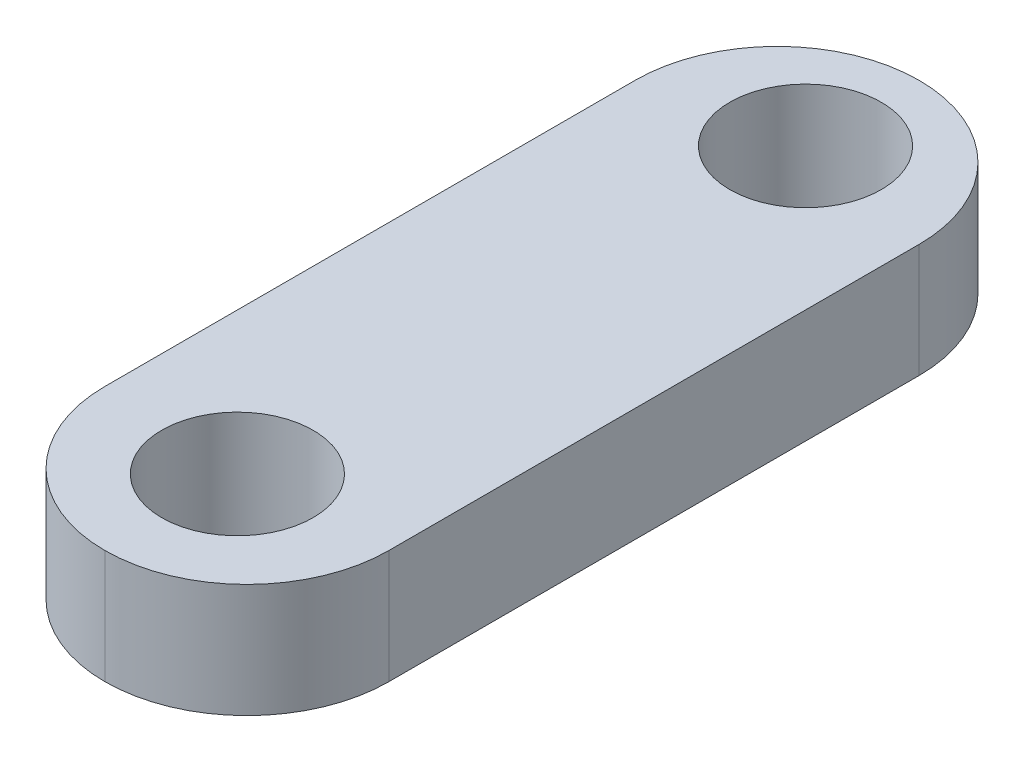
from build123d import *

# Parameters (mm, degrees)
SKETCH1_W           = 15
SKETCH1_H           = 43
BOSS_EXTRUDE1_DEPTH = 6
SKETCH4_R           = 4
CUT_EXTRUDE2_DEPTH  = 46.934736311
FILLET1_R           = 7.5


with BuildPart() as part:
    # Sketch1 → Boss-Extrude1 (new body)
    with BuildSketch(Plane(origin=(0, 0, 0), x_dir=(1, 0, 0), z_dir=(0, 1, 0))):
        with Locations((7.5, 21.5)):
            Rectangle(SKETCH1_W, SKETCH1_H)
    extrude(amount=BOSS_EXTRUDE1_DEPTH)

    # Sketch4 → Cut-Extrude2 (cut, through all)
    with BuildSketch(Plane(origin=(0, 6, 0), x_dir=(1, 0, 0), z_dir=(0, 1, 0))):
        with Locations(Location((7.5, 37, 0), (0, 0, 270))):
            Circle(SKETCH4_R)
        with Locations(Location((7.5, 7, 0), (0, 0, 270))):
            Circle(SKETCH4_R)
    extrude(amount=-CUT_EXTRUDE2_DEPTH, mode=Mode.SUBTRACT)

    # Fillet1
    fillet1_edges = [part.edges().sort_by_distance(p)[0] for p in [
        (0, 3, 0),
        (15, 3, 0),
        (15, 3, -43),
        (0, 3, -43),
    ]]
    fillet(fillet1_edges, radius=FILLET1_R - 0.0001)  # a hair under: the kernel refuses the full size


solid = part.part
